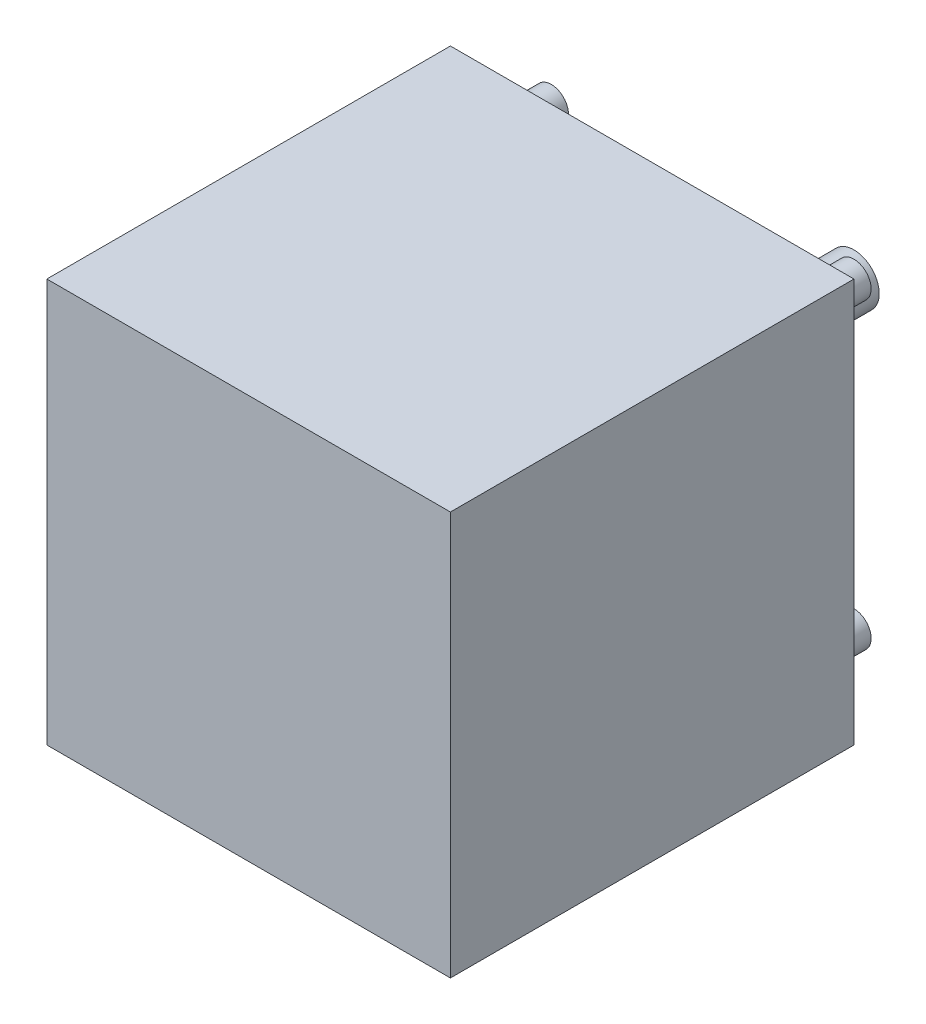
from build123d import *

# Parameters (mm, degrees)
SKETCH1_W               = 40
SKETCH1_H               = 40
BOSS_EXTRUDE1_DEPTH     = 40
SKETCH2_R               = 1.7
BOSS_EXTRUDE2_DEPTH     = 5
MIRROR2_COPY_1_SKETCH_R = 1.7
MIRROR2_COPY_1_DEPTH    = 5
MIRROR2_COPY_2_SKETCH_R = 1.7
MIRROR2_COPY_2_DEPTH    = 5
SKETCH3_R               = 2.5
BOSS_EXTRUDE3_DEPTH     = 20


with BuildPart() as part:
    # Sketch1 → Boss-Extrude1 (new body)
    with BuildSketch(Plane.XY):
        Rectangle(SKETCH1_W, SKETCH1_H)
    extrude(amount=BOSS_EXTRUDE1_DEPTH)

    # Sketch2 → Boss-Extrude2 (add)
    with BuildSketch(Plane(origin=(0, 0, 0), x_dir=(-1, 0, 0), z_dir=(0, 0, -1))):
        with Locations((15, -15)):
            Circle(SKETCH2_R)
    boss_extrude2 = extrude(amount=BOSS_EXTRUDE2_DEPTH)

    # Mirror1: Boss-Extrude2 across plane
    add(boss_extrude2.mirror(Plane(origin=(0, 0, 0), x_dir=(0, 0, 1), z_dir=(1, 0, 0))))

    # Mirror2 copy 1 sketch → Mirror2 copy 1 (add)
    with BuildSketch(Plane(origin=(0, 0, 0), x_dir=(1, 0, 0), z_dir=(0, 0, -1))):
        with Locations((15, -15)):
            Circle(MIRROR2_COPY_1_SKETCH_R)
    extrude(amount=MIRROR2_COPY_1_DEPTH)

    # Mirror2 copy 2 sketch → Mirror2 copy 2 (add)
    with BuildSketch(Plane(origin=(0, 0, 0), x_dir=(-1, 0, 0), z_dir=(0, 0, -1))):
        with Locations((15, 15)):
            Circle(MIRROR2_COPY_2_SKETCH_R)
    extrude(amount=MIRROR2_COPY_2_DEPTH)

    # Sketch3 → Boss-Extrude3 (add)
    with BuildSketch(Plane(origin=(0, 0, 0), x_dir=(-1, 0, 0), z_dir=(0, 0, -1))):
        Circle(SKETCH3_R)
    extrude(amount=BOSS_EXTRUDE3_DEPTH)


solid = part.part
